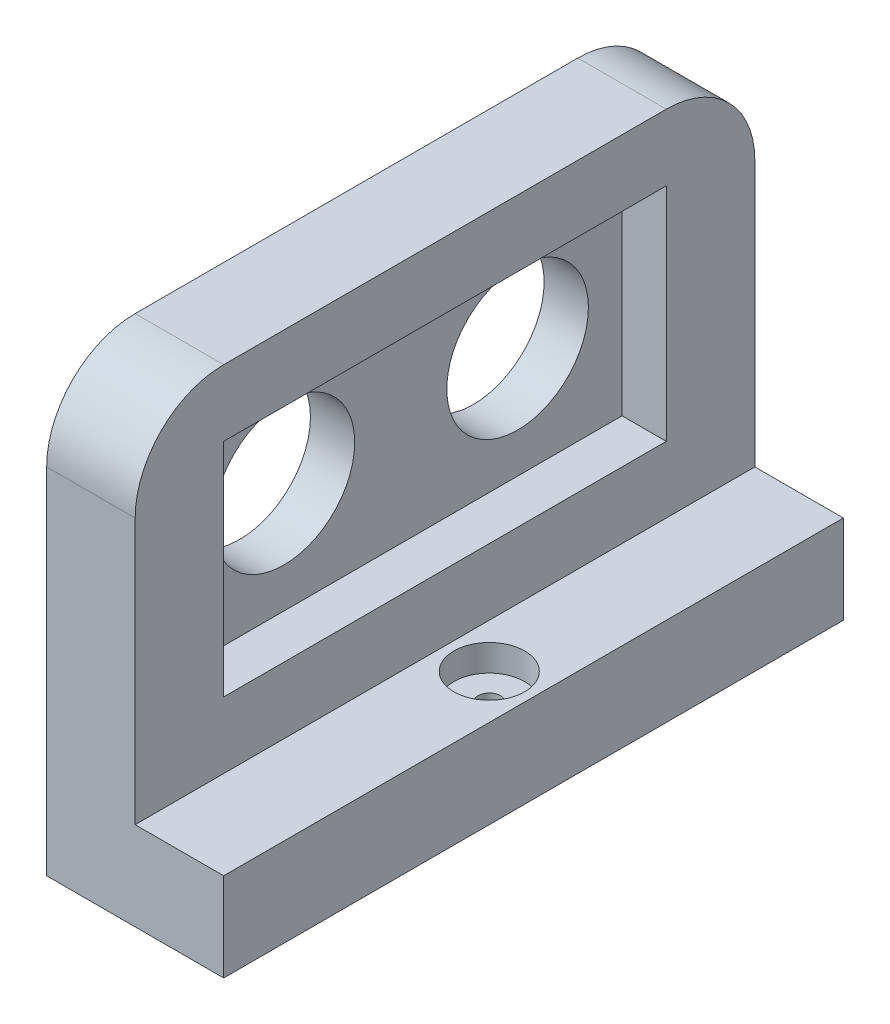
from build123d import *

# Parameters (mm, degrees)
BOSS_EXTRUDE1_DEPTH = 70
SKETCH2_R           = 8
CUT_EXTRUDE9_DEPTH  = 87.602540378
SKETCH2_12_R        = 8
CUT_EXTRUDE10_DEPTH = 87.602540378
SKETCH2_14_W        = 50
SKETCH2_14_H        = 25
CUT_EXTRUDE12_DEPTH = 5
SKETCH3_R           = 4
SKETCH3_R_2         = 1.25
CUT_EXTRUDE13_DEPTH = 3
SKETCH3_2_R         = 1.25
CUT_EXTRUDE14_DEPTH = 84.066238629
FILLET1_R           = 10
FILLET2_R           = 10


with BuildPart() as part:
    # Sketch1 → Boss-Extrude1 (new body)
    with BuildSketch(Plane.XY):
        Polygon((0, 0), (0, 10), (-10, 10), (-10, 50), (-20, 50), (-20, 0), align=None)
    extrude(amount=BOSS_EXTRUDE1_DEPTH)

    # Sketch2 → Cut-Extrude9 (cut, through all)
    with BuildSketch(Plane(origin=(-10, 0, 0), x_dir=(0, 0, -1), z_dir=(1, 0, 0))):
        with Locations((-48.2, 30)):
            Circle(SKETCH2_R)
    extrude(amount=-CUT_EXTRUDE9_DEPTH, mode=Mode.SUBTRACT)

    # Sketch2<12> → Cut-Extrude10 (cut, through all)
    with BuildSketch(Plane(origin=(-10, 0, 0), x_dir=(0, 0, -1), z_dir=(1, 0, 0))):
        with Locations((-21.8, 30)):
            Circle(SKETCH2_12_R)
    extrude(amount=-CUT_EXTRUDE10_DEPTH, mode=Mode.SUBTRACT)

    # Sketch2<14> → Cut-Extrude12 (cut)
    with BuildSketch(Plane(origin=(-10, 0, 0), x_dir=(0, 0, -1), z_dir=(1, 0, 0))):
        with Locations((-35, 30)):
            Rectangle(SKETCH2_14_W, SKETCH2_14_H)
    extrude(amount=-CUT_EXTRUDE12_DEPTH, mode=Mode.SUBTRACT)

    # Sketch3 → Cut-Extrude13 (cut)
    with BuildSketch(Plane(origin=(0, 10, 0), x_dir=(1, 0, 0), z_dir=(0, 1, 0))):
        with Locations((-5, -35)):
            Circle(SKETCH3_R)
        with Locations((-5, -35)):
            Circle(SKETCH3_R_2, mode=Mode.SUBTRACT)
    extrude(amount=-CUT_EXTRUDE13_DEPTH, mode=Mode.SUBTRACT)

    # Sketch3<2> → Cut-Extrude14 (cut, through all)
    with BuildSketch(Plane(origin=(0, 10, 0), x_dir=(1, 0, 0), z_dir=(0, 1, 0))):
        with Locations((-5, -35)):
            Circle(SKETCH3_2_R)
    extrude(amount=-CUT_EXTRUDE14_DEPTH, mode=Mode.SUBTRACT)

    # Fillet1
    fillet1_edges = [part.edges().sort_by_distance(p)[0] for p in [
        (-15, 50, 70),
    ]]
    fillet(fillet1_edges, radius=FILLET1_R)

    # Fillet2
    fillet2_edges = [part.edges().sort_by_distance(p)[0] for p in [
        (-15, 50, 0),
    ]]
    fillet(fillet2_edges, radius=FILLET2_R)


solid = part.part
